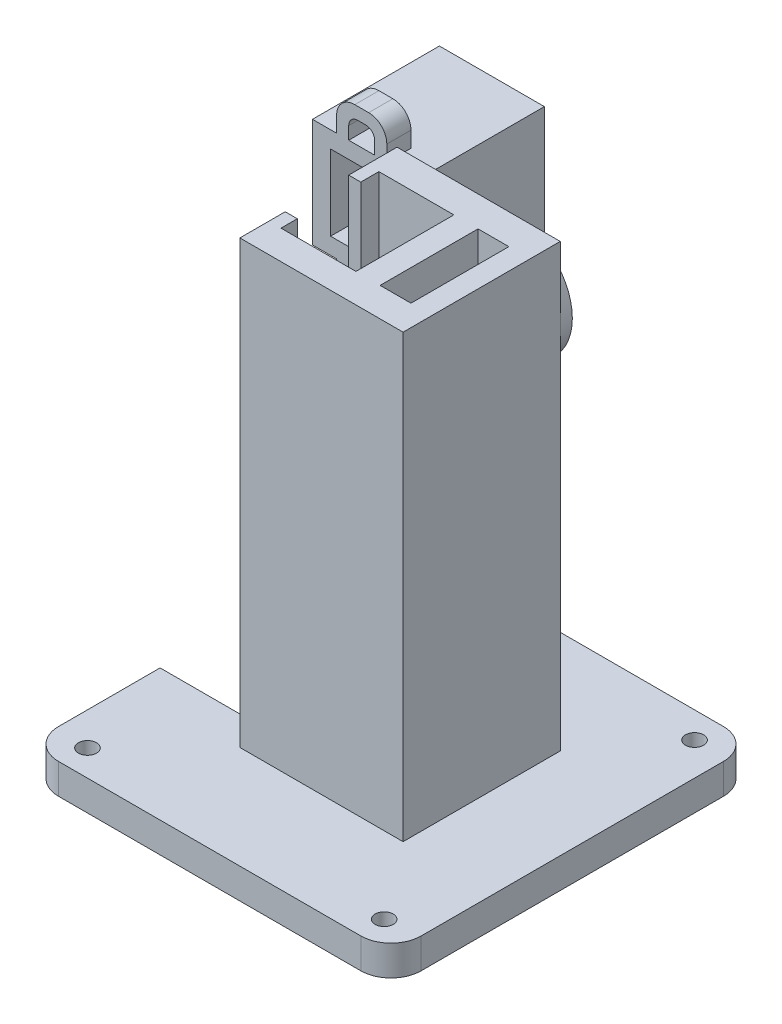
from build123d import *

# Parameters (mm, degrees)
SKETCH1_W                    = 30
SKETCH1_H                    = 73
BOSS_EXTRUDE1_DEPTH          = 26
SKETCH2_W                    = 25
SKETCH2_H                    = 16.2
CUT_EXTRUDE1_DEPTH           = 79.930349043
SKETCH3_W                    = 26
SKETCH3_H                    = 24
SKETCH3_H_2                  = 16.23422306
CUT_EXTRUDE2_DEPTH           = 5
SKETCH5_W                    = 60
SKETCH5_H                    = 60
BOSS_EXTRUDE2_DEPTH          = 5
FILLET1_R                    = 5
SKETCH6_R                    = 1.5
CUT_EXTRUDE4_DEPTH           = 5
SKETCH7_R                    = 1
CUT_EXTRUDE5_DEPTH           = 4
SKETCH8_W                    = 15.5
SKETCH8_H                    = 5
CUT_EXTRUDE6_DEPTH           = 42
SKETCH9_W                    = 5
SKETCH9_H                    = 26
CUT_EXTRUDE7_DEPTH           = 73
SKETCH10_W                   = 2
SKETCH10_H                   = 8
SKETCH10_H_2                 = 7.5
BOSS_EXTRUDE3_DEPTH          = 78
SKETCH11_W                   = 41.5
SKETCH11_H                   = 0.7
CUT_EXTRUDE8_DEPTH           = 90.877694674
SKETCH13_W                   = 0.7
SKETCH13_H                   = 5
BOSS_EXTRUDE5_DEPTH          = 2
SKETCH15_W                   = 4
SKETCH15_H                   = 16.2
BOSS_EXTRUDE6_DEPTH          = 78
MOTOR_START                  = 62.773326215
MOTOR_PLATFORM_OUTLINE_W     = 17.3641812
MOTOR_PLATFORM_OUTLINE_H     = 18
MOTOR_PLATFORM_OUTLINE_W_2   = 10.8
MOTOR_PLATFORM_OUTLINE_H_2   = 12.5
MOTOR_PLATFORM_DEPTH         = 21
MOTOR_PLATFORM_2_OUTLINE_R   = 1
MOTOR_PLATFORM_2_OUTLINE_R_2 = 3
MOTOR_PLATFORM_2_DEPTH       = 2
MOTOR_START_2                = 64.773326215
MOTOR_PLATFORM_3_DEPTH       = 2
MOTOR_START_3                = 82.773326215
MOTOR_PLATFORM_4_OUTLINE_W   = 10.8
MOTOR_PLATFORM_4_OUTLINE_H   = 12.5
MOTOR_PLATFORM_4_DEPTH       = 1
BODY_MOVE_COPY1_ANGLE        = 180


with BuildPart() as part:
    # Sketch1 → Boss-Extrude1 (new body)
    with BuildSketch(Plane.XY):
        Rectangle(SKETCH1_W, SKETCH1_H)
    extrude(amount=BOSS_EXTRUDE1_DEPTH)

    # Sketch2 → Cut-Extrude1 (cut, through all)
    with BuildSketch(Plane(origin=(0, 36.5, 0), x_dir=(1, 0, 0), z_dir=(0, 1, 0))):
        with Locations((-1, -13.1)):
            Rectangle(SKETCH2_W, SKETCH2_H)
    extrude(amount=-CUT_EXTRUDE1_DEPTH, mode=Mode.SUBTRACT)

    # Sketch3 → Cut-Extrude2 (cut)
    with BuildSketch(Plane.ZY.offset(15)):
        with Locations((13, 21.5)):
            Rectangle(SKETCH3_W, SKETCH3_H)
        with Locations((13, -5.5)):
            Rectangle(SKETCH3_W, SKETCH3_H)
        with Locations((13, -28.61711153)):
            Rectangle(SKETCH3_W, SKETCH3_H_2)
    extrude(amount=-CUT_EXTRUDE2_DEPTH, mode=Mode.SUBTRACT)

    # Sketch5 → Boss-Extrude2 (add)
    with BuildSketch(Plane(origin=(0, -36.5, 0), x_dir=(-1, 0, 0), z_dir=(0, -1, 0))):
        with Locations((0, -13)):
            Rectangle(SKETCH5_W, SKETCH5_H)
    extrude(amount=BOSS_EXTRUDE2_DEPTH)

    # Fillet1
    fillet1_edges = [part.edges().sort_by_distance(p)[0] for p in [
        (30, -39, -17),
        (30, -39, 43),
        (-30, -39, 43),
        (-30, -39, -17),
    ]]
    fillet(fillet1_edges, radius=FILLET1_R)

    # Sketch6 → Cut-Extrude4 (cut)
    with BuildSketch(Plane(origin=(0, -36.5, 0), x_dir=(1, 0, 0), z_dir=(0, 1, 0))):
        with Locations(Location((-24.540514854, 12.671548216, 0), (0, 0, 180))):
            Circle(SKETCH6_R)
        with Locations((24.540514854, 12.671548216)):
            Circle(SKETCH6_R)
        with Locations((-24.540514854, -38.671548216)):
            Circle(SKETCH6_R)
        with Locations(Location((24.540514854, -38.671548216, 0), (0, 0, 180))):
            Circle(SKETCH6_R)
    extrude(amount=-CUT_EXTRUDE4_DEPTH, mode=Mode.SUBTRACT)

    # Sketch7 → Cut-Extrude5 (cut)
    with BuildSketch(Plane(origin=(0, 0, 0), x_dir=(-1, 0, 0), z_dir=(0, 0, -1))):
        with Locations((-7, 31.5)):
            Circle(SKETCH7_R)
        with Locations((-12, 24.5)):
            Circle(SKETCH7_R)
        with Locations((-2, 24.5)):
            Circle(SKETCH7_R)
        with Locations((-7, 18.5)):
            Circle(SKETCH7_R)
    extrude(amount=-CUT_EXTRUDE5_DEPTH, mode=Mode.SUBTRACT)

    # Sketch8 → Cut-Extrude6 (cut)
    with BuildSketch(Plane.ZY.offset(30)):
        with Locations((12.75, -39)):
            Rectangle(SKETCH8_W, SKETCH8_H)
    extrude(amount=-CUT_EXTRUDE6_DEPTH, mode=Mode.SUBTRACT)

    # Sketch9 → Cut-Extrude7 (cut)
    with BuildSketch(Plane(origin=(0, 36.5, 0), x_dir=(1, 0, 0), z_dir=(0, 1, 0))):
        with Locations((-12.5, -13)):
            Rectangle(SKETCH9_W, SKETCH9_H)
    extrude(amount=-CUT_EXTRUDE7_DEPTH, mode=Mode.SUBTRACT)

    # Sketch10 → Boss-Extrude3 (add)
    with BuildSketch(Plane(origin=(0, 36.5, 0), x_dir=(1, 0, 0), z_dir=(0, 1, 0))):
        with Locations((-11, -4)):
            Rectangle(SKETCH10_W, SKETCH10_H)
        with Locations((-11, -22.25)):
            Rectangle(SKETCH10_W, SKETCH10_H_2)
    extrude(amount=-BOSS_EXTRUDE3_DEPTH)

    # Sketch11 → Cut-Extrude8 (cut, through all)
    with BuildSketch(Plane(origin=(0, -36.5, 0), x_dir=(1, 0, 0), z_dir=(0, 1, 0))):
        with Locations((-9.25, -20.85)):
            Rectangle(SKETCH11_W, SKETCH11_H)
    extrude(amount=-CUT_EXTRUDE8_DEPTH, mode=Mode.SUBTRACT)

    # Sketch13 → Boss-Extrude5 (add)
    with BuildSketch(Plane.ZY.offset(12)):
        with Locations((20.85, -39)):
            Rectangle(SKETCH13_W, SKETCH13_H)
    extrude(amount=-BOSS_EXTRUDE5_DEPTH)

    # Sketch15 → Boss-Extrude6 (add)
    with BuildSketch(Plane(origin=(0, 36.5, 0), x_dir=(1, 0, 0), z_dir=(0, 1, 0))):
        with Locations((4.4, -13.1)):
            Rectangle(SKETCH15_W, SKETCH15_H)
    extrude(amount=-BOSS_EXTRUDE6_DEPTH)


with BuildPart() as body_2:
    # motor platform: read off the stored shape, not the designer's step
    # motor platform outline → motor platform (new body)
    with BuildSketch(Plane.XY.offset(MOTOR_START)):
        with Locations((55.40107427, 57.368007859)):
            Rectangle(MOTOR_PLATFORM_OUTLINE_W, MOTOR_PLATFORM_OUTLINE_H)
        with Locations((55.68316487, 57.368007859)):
            Rectangle(MOTOR_PLATFORM_OUTLINE_W_2, MOTOR_PLATFORM_OUTLINE_H_2, mode=Mode.SUBTRACT)
    extrude(amount=MOTOR_PLATFORM_DEPTH)

    # motor platform 2 outline → motor platform 2 (add)
    # profile 1 of 3: a face of its own
    with BuildSketch(Plane.XY.offset(MOTOR_START)):
        with BuildLine():
            Line((60.08316487, 45.768007859), (60.08316487, 48.368007859))
            Line((60.08316487, 48.368007859), (58.08316487, 48.368007859))
            Line((58.08316487, 48.368007859), (58.08316487, 46.268007859))
            ThreePointArc((58.08316487, 46.268007859), (57.643825042, 45.207347687), (56.58316487, 44.768007859))
            Line((56.58316487, 44.768007859), (55.28316487, 44.768007859))
            ThreePointArc((55.28316487, 44.768007859), (54.222504698, 45.207347687), (53.78316487, 46.268007859))
            Line((53.78316487, 46.268007859), (53.78316487, 48.368007859))
            Line((53.78316487, 48.368007859), (51.78316487, 48.368007859))
            Line((51.78316487, 48.368007859), (51.78316487, 45.768007859))
            ThreePointArc((51.78316487, 45.768007859), (52.661844527, 43.646687515), (54.78316487, 42.768007859))
            Line((54.78316487, 42.768007859), (57.08316487, 42.768007859))
            ThreePointArc((57.08316487, 42.768007859), (59.204485214, 43.646687515), (60.08316487, 45.768007859))
        make_face()
    # profile 2 of 3: a face of its own
    with BuildSketch(Plane.XY.offset(MOTOR_START)):
        with BuildLine():
            Line((58.08316487, 66.368007859), (60.08316487, 66.368007859))
            Line((60.08316487, 66.368007859), (60.08316487, 68.968007859))
            ThreePointArc((60.08316487, 68.968007859), (59.204485214, 71.089328202), (57.08316487, 71.968007859))
            Line((57.08316487, 71.968007859), (54.78316487, 71.968007859))
            ThreePointArc((54.78316487, 71.968007859), (52.661844527, 71.089328202), (51.78316487, 68.968007859))
            Line((51.78316487, 68.968007859), (51.78316487, 66.368007859))
            Line((51.78316487, 66.368007859), (53.78316487, 66.368007859))
            Line((53.78316487, 66.368007859), (53.78316487, 68.468007859))
            ThreePointArc((53.78316487, 68.468007859), (54.222504698, 69.528668031), (55.28316487, 69.968007859))
            Line((55.28316487, 69.968007859), (56.58316487, 69.968007859))
            ThreePointArc((56.58316487, 69.968007859), (57.643825042, 69.528668031), (58.08316487, 68.468007859))
            Line((58.08316487, 68.468007859), (58.08316487, 66.368007859))
        make_face()
    # profile 3 of 3: a face of its own
    with BuildSketch(Plane.XY.offset(MOTOR_START)):
        with BuildLine():
            Line((29.354802469, 48.368007859), (46.71898367, 48.368007859))
            Line((46.71898367, 48.368007859), (46.71898367, 66.368007859))
            Line((46.71898367, 66.368007859), (29.354802469, 66.368007859))
            ThreePointArc((29.354802469, 66.368007859), (23.090237203, 57.368007859), (29.354802469, 48.368007859))
        make_face()
        with Locations((31.09028738, 51.368007859)):
            Circle(MOTOR_PLATFORM_2_OUTLINE_R, mode=Mode.SUBTRACT)
        with Locations((26.09028738, 57.368007859)):
            Circle(MOTOR_PLATFORM_2_OUTLINE_R, mode=Mode.SUBTRACT)
        with Locations((31.09028738, 58.868007859)):
            Circle(MOTOR_PLATFORM_2_OUTLINE_R_2, mode=Mode.SUBTRACT)
        with Locations((31.09028738, 64.368007859)):
            Circle(MOTOR_PLATFORM_2_OUTLINE_R, mode=Mode.SUBTRACT)
        with Locations((36.09028738, 57.368007859)):
            Circle(MOTOR_PLATFORM_2_OUTLINE_R, mode=Mode.SUBTRACT)
    extrude(amount=MOTOR_PLATFORM_2_DEPTH)

    # motor platform 3 outline → motor platform 3 (add)
    with BuildSketch(Plane.XY.offset(MOTOR_START_2)):
        with BuildLine():
            Line((60.08316487, 45.768007859), (60.08316487, 48.368007859))
            Line((60.08316487, 48.368007859), (58.08316487, 48.368007859))
            Line((58.08316487, 48.368007859), (58.08316487, 46.268007859))
            ThreePointArc((58.08316487, 46.268007859), (57.643825042, 45.207347687), (56.58316487, 44.768007859))
            Line((56.58316487, 44.768007859), (55.28316487, 44.768007859))
            ThreePointArc((55.28316487, 44.768007859), (54.222504698, 45.207347687), (53.78316487, 46.268007859))
            Line((53.78316487, 46.268007859), (53.78316487, 48.368007859))
            Line((53.78316487, 48.368007859), (51.78316487, 48.368007859))
            Line((51.78316487, 48.368007859), (51.78316487, 45.768007859))
            ThreePointArc((51.78316487, 45.768007859), (52.661844527, 43.646687515), (54.78316487, 42.768007859))
            Line((54.78316487, 42.768007859), (57.08316487, 42.768007859))
            ThreePointArc((57.08316487, 42.768007859), (59.204485214, 43.646687515), (60.08316487, 45.768007859))
        make_face()
        with BuildLine():
            Line((58.08316487, 66.368007859), (60.08316487, 66.368007859))
            Line((60.08316487, 66.368007859), (60.08316487, 68.968007859))
            ThreePointArc((60.08316487, 68.968007859), (59.204485214, 71.089328202), (57.08316487, 71.968007859))
            Line((57.08316487, 71.968007859), (54.78316487, 71.968007859))
            ThreePointArc((54.78316487, 71.968007859), (52.661844527, 71.089328202), (51.78316487, 68.968007859))
            Line((51.78316487, 68.968007859), (51.78316487, 66.368007859))
            Line((51.78316487, 66.368007859), (53.78316487, 66.368007859))
            Line((53.78316487, 66.368007859), (53.78316487, 68.468007859))
            ThreePointArc((53.78316487, 68.468007859), (54.222504698, 69.528668031), (55.28316487, 69.968007859))
            Line((55.28316487, 69.968007859), (56.58316487, 69.968007859))
            ThreePointArc((56.58316487, 69.968007859), (57.643825042, 69.528668031), (58.08316487, 68.468007859))
            Line((58.08316487, 68.468007859), (58.08316487, 66.368007859))
        make_face()
    extrude(amount=MOTOR_PLATFORM_3_DEPTH)

    # motor platform 4 outline → motor platform 4 (add)
    with BuildSketch(Plane.XY.offset(MOTOR_START_3)):
        with Locations((55.68316487, 57.368007859)):
            Rectangle(MOTOR_PLATFORM_4_OUTLINE_W, MOTOR_PLATFORM_4_OUTLINE_H)
        with BuildLine():
            ThreePointArc((53.061742153, 60.583943356), (55.561742153, 63.083943356), (58.061742153, 60.583943356))
            Line((58.061742153, 60.583943356), (58.061742153, 54.583943356))
            ThreePointArc((58.061742153, 54.583943356), (55.561742153, 52.083943356), (53.061742153, 54.583943356))
            Line((53.061742153, 54.583943356), (53.061742153, 60.583943356))
        make_face(mode=Mode.SUBTRACT)
    extrude(amount=MOTOR_PLATFORM_4_DEPTH)


with BuildPart() as body_2_1:
    # Body-Move/Copy1: read off the stored shape, not the designer's step
    # Body-Move/Copy1: moved
    add(body_2.part.moved(Location((-38.0902874, -32.8680079, -62.7733262))).rotate(Axis((0, 0, 0), (0, 1, 0)), BODY_MOVE_COPY1_ANGLE))


solid = Compound([part.part, body_2_1.part])
